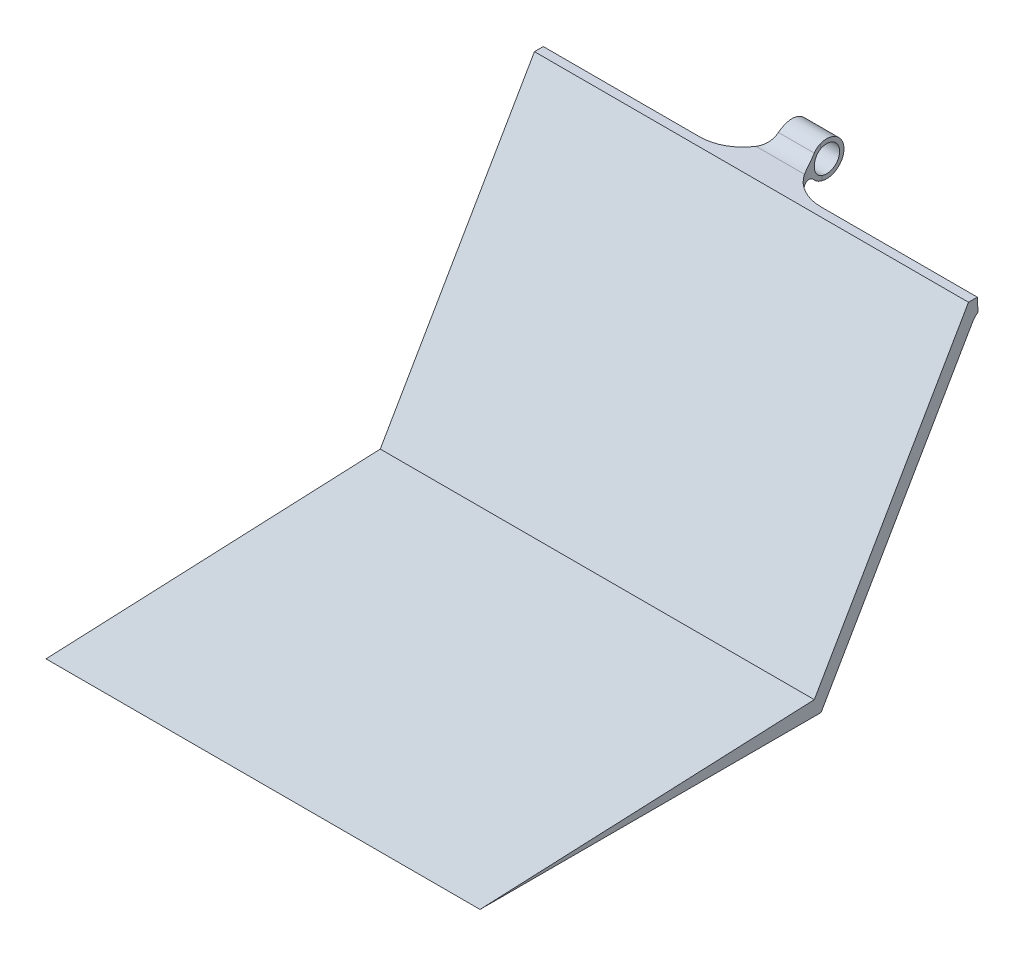
from build123d import *

# Parameters (mm, degrees)
SKETCH1_R           = 3
BOSS_EXTRUDE1_DEPTH = 50
SKETCH2_W           = 49.237563161
SKETCH2_H           = 20.165956609
CUT_EXTRUDE1_DEPTH  = 35
FILLET1_R           = 10
FILLET3_START       = -50
FILLET3_DEPTH       = 100
FILLET3_START_2     = -14.0000001
FILLET3_2_DEPTH     = 28.0000001
FILLET3_START_3     = 5.029081153
FILLET3_3_DEPTH     = 7.627254367
FILLET4_R           = 5


with BuildPart() as part:
    # Sketch1 → Boss-Extrude1 (new, symmetric)
    with BuildSketch(Plane(origin=(0, 0, 0), x_dir=(0, 0, -1), z_dir=(1, 0, 0))):
        with BuildLine():
            Line((8.951712986, 8.463111178), (1.809964066, 8.463111178))
            Line((1.809964066, 8.463111178), (-10.541427431, -12.930126439))
            Line((-10.541427431, -12.930126439), (-20.432636562, -30.062203202))
            Line((-20.432636562, -30.062203202), (-34.461620266, -54.361115756))
            Line((-34.461620266, -54.361115756), (-113.02909109, -54.361115756))
            Line((-113.02909109, -54.361115756), (-36.018105083, -51.005100845))
            Line((-36.018105083, -51.005100845), (-0.492985983, 10.526210382))
            Line((-0.492985983, 10.526210382), (8.951712986, 10.526210382))
            ThreePointArc((8.951712986, 10.526210382), (16.816412899, 9.49466078), (8.951712986, 8.463111178))
        make_face()
        with Locations((12.816412899, 9.49466078)):
            Circle(SKETCH1_R, mode=Mode.SUBTRACT)
    extrude(amount=BOSS_EXTRUDE1_DEPTH, both=True)

    # Sketch2 → Cut-Extrude1 (cut, symmetric)
    with BuildSketch(Plane(origin=(0, -11.420787425, -0.571112862), x_dir=(1, 0, 0), z_dir=(0, 0.9987520183198841, 0.04994402769058576))):
        Polygon((-41.345711691, -80.976381383), (-37.345711691, -80.976381383), (-37.345711691, -96.642858944), (-33.68226718, -102.621642139), (-29.345711691, -96.642858944), (-29.345711691, -80.976381383), (-25.345711691, -80.976381383), (-25.345711691, -96.642858944), (-21.68226718, -102.621642139), (-17.345711691, -96.642858944), (-17.345711691, -80.976381383), (-13.345711691, -80.976381383), (-13.345711691, -96.642858944), (-9.68226718, -102.621642139), (-5.345711691, -96.642858944), (-5.345711691, -80.976381383), (-1.345711691, -80.976381383), (-1.345711691, -96.642858944), (2.31773282, -102.621642139), (6.654288309, -96.642858944), (6.654288309, -80.976381383), (10.654288309, -80.976381383), (10.654288309, -96.642858944), (14.31773282, -102.621642139), (18.654288309, -96.642858944), (18.654288309, -80.976381383), (22.654288309, -80.976381383), (22.654288309, -96.642858944), (26.31773282, -102.621642139), (30.654288309, -96.642858944), (30.654288309, -80.976381383), (34.654288309, -80.976381383), (34.654288309, -96.642858944), (38.31773282, -102.621642139), (42.654288309, -96.642858944), (42.654288309, -80.976381383), (46.654288309, -80.976381383), (46.654288309, -96.642858944), (50.31773282, -102.621642139), (54.654288309, -96.642858944), (54.654288309, -80.976381383), (58.654288309, -80.976381383), (58.654288309, -96.642858944), (58.654288309, -117.647520094), (-58.342792285, -117.647520094), (-58.342792285, -96.642858944), (-49.345711691, -96.642858944), (-45.68226718, -102.621642139), (-41.345711691, -96.642858944), align=None)
        with Locations((-28.618781581, 12.150846953)):
            Rectangle(SKETCH2_W, SKETCH2_H)
        with Locations((28.618781581, 12.150846953)):
            Rectangle(SKETCH2_W, SKETCH2_H)
    extrude(amount=CUT_EXTRUDE1_DEPTH, both=True, mode=Mode.SUBTRACT)

    # Fillet1
    # the kernel refuses this fillet: 10 mm, written as the material it adds along each edge
    with BuildSketch(Plane(origin=(-4, 35.49501084, -0.295473589), x_dir=(0, 0.049944027690585764, -0.9987520183198841), z_dir=(0, -0.9987520183198841, -0.04994402769058576))) as fillet1_piece_1_section:
        with BuildLine():
            CenterArc((FILLET1_R, -FILLET1_R), FILLET1_R, 90, 90)
            Line((0, -FILLET1_R), (0, 0))
            Line((0, 0), (FILLET1_R, 0))
        make_face()
    fillet1_piece_1 = extrude(amount=52.325377672, mode=Mode.PRIVATE)
    fillet1_piece_1 = split(fillet1_piece_1, bisect_by=Plane(origin=(-4, 8.463111178, -0.295473589), z_dir=(0, 1, 0)), keep=Keep.TOP, mode=Mode.PRIVATE)
    fillet1_piece_1 = split(fillet1_piece_1, bisect_by=Plane(origin=(-4, 10.526210382, -0.295473589), z_dir=(0, -1, 0)), keep=Keep.TOP, mode=Mode.PRIVATE)
    fillet1_piece_1 = fillet1_piece_1 - Plane(origin=(-4, 9.49466078, -12.816412899), x_dir=(0, 0, -1), z_dir=(-1, 0, 0)) * Cylinder(3, 145, mode=Mode.PRIVATE)
    add(fillet1_piece_1)
    with BuildSketch(Plane(origin=(-4, 35.49501084, -0.295473589), x_dir=(0, 0.049944027690585764, -0.9987520183198841), z_dir=(0, -0.9987520183198841, -0.04994402769058576))) as fillet1_piece_2_section:
        with BuildLine():
            CenterArc((FILLET1_R, -FILLET1_R), FILLET1_R, 90, 90)
            Line((0, -FILLET1_R), (0, 0))
            Line((0, 0), (FILLET1_R, 0))
        make_face()
    fillet1_piece_2 = extrude(amount=52.325377672, mode=Mode.PRIVATE)
    fillet1_piece_2 = split(fillet1_piece_2, bisect_by=Plane(origin=(-4, 28.081242311, -13.136497357), z_dir=(0, 0.4999999999999977, 0.8660254037844399)), keep=Keep.TOP, mode=Mode.PRIVATE)
    fillet1_piece_2 = split(fillet1_piece_2, bisect_by=Plane(origin=(-4, 10.526210382, -0.295473589), z_dir=(0, -1, 0)), keep=Keep.TOP, mode=Mode.PRIVATE)
    add(fillet1_piece_2)
    with BuildSketch(Plane(origin=(-4, 35.49501084, -0.295473589), x_dir=(0, 0.049944027690585764, -0.9987520183198841), z_dir=(0, -0.9987520183198841, -0.04994402769058576))) as fillet1_piece_3_section:
        with BuildLine():
            CenterArc((FILLET1_R, -FILLET1_R), FILLET1_R, 90, 90)
            Line((0, -FILLET1_R), (0, 0))
            Line((0, 0), (FILLET1_R, 0))
        make_face()
    fillet1_piece_3 = extrude(amount=52.325377672, mode=Mode.PRIVATE)
    fillet1_piece_3 = fillet1_piece_3 & Plane(origin=(-4, 9.49466078, -12.816412899), x_dir=(0, 0.2578874004491323, 0.9661749782982318), z_dir=(1, 0, 0)) * Cylinder(4, 145, mode=Mode.PRIVATE)
    fillet1_piece_3 = fillet1_piece_3 - Plane(origin=(-4, 9.49466078, -12.816412899), x_dir=(0, 0, -1), z_dir=(-1, 0, 0)) * Cylinder(3, 145, mode=Mode.PRIVATE)
    add(fillet1_piece_3)
    with BuildSketch(Plane(origin=(4, -16.76506572, -2.908813701), x_dir=(0, 0.049944027690585764, -0.9987520183198841), z_dir=(0, 0.9987520183198841, 0.04994402769058576))) as fillet1_piece_4_section:
        with BuildLine():
            CenterArc((FILLET1_R, -FILLET1_R), FILLET1_R, 90, 90)
            Line((0, -FILLET1_R), (0, 0))
            Line((0, 0), (FILLET1_R, 0))
        make_face()
    fillet1_piece_4 = extrude(amount=52.325377672, mode=Mode.PRIVATE)
    fillet1_piece_4 = split(fillet1_piece_4, bisect_by=Plane(origin=(4, -9.982205646, 8.839444568), z_dir=(0, 0.4999999999999977, 0.8660254037844399)), keep=Keep.TOP, mode=Mode.PRIVATE)
    fillet1_piece_4 = split(fillet1_piece_4, bisect_by=Plane(origin=(4, 10.526210382, -2.908813701), z_dir=(0, -1, 0)), keep=Keep.TOP, mode=Mode.PRIVATE)
    add(fillet1_piece_4)
    with BuildSketch(Plane(origin=(4, -16.76506572, -2.908813701), x_dir=(0, 0.049944027690585764, -0.9987520183198841), z_dir=(0, 0.9987520183198841, 0.04994402769058576))) as fillet1_piece_5_section:
        with BuildLine():
            CenterArc((FILLET1_R, -FILLET1_R), FILLET1_R, 90, 90)
            Line((0, -FILLET1_R), (0, 0))
            Line((0, 0), (FILLET1_R, 0))
        make_face()
    fillet1_piece_5 = extrude(amount=52.325377672, mode=Mode.PRIVATE)
    fillet1_piece_5 = split(fillet1_piece_5, bisect_by=Plane(origin=(4, 8.463111178, -2.908813701), z_dir=(0, 1, 0)), keep=Keep.TOP, mode=Mode.PRIVATE)
    fillet1_piece_5 = split(fillet1_piece_5, bisect_by=Plane(origin=(4, 10.526210382, -2.908813701), z_dir=(0, -1, 0)), keep=Keep.TOP, mode=Mode.PRIVATE)
    fillet1_piece_5 = fillet1_piece_5 - Plane(origin=(4, 9.49466078, -12.816412899), x_dir=(0, 0, -1), z_dir=(-1, 0, 0)) * Cylinder(3, 145, mode=Mode.PRIVATE)
    add(fillet1_piece_5)
    with BuildSketch(Plane(origin=(4, -16.76506572, -2.908813701), x_dir=(0, 0.049944027690585764, -0.9987520183198841), z_dir=(0, 0.9987520183198841, 0.04994402769058576))) as fillet1_piece_6_section:
        with BuildLine():
            CenterArc((FILLET1_R, -FILLET1_R), FILLET1_R, 90, 90)
            Line((0, -FILLET1_R), (0, 0))
            Line((0, 0), (FILLET1_R, 0))
        make_face()
    fillet1_piece_6 = extrude(amount=52.325377672, mode=Mode.PRIVATE)
    fillet1_piece_6 = fillet1_piece_6 & Plane(origin=(4, 9.49466078, -12.816412899), x_dir=(0, 0.2578874004491323, 0.9661749782982318), z_dir=(1, 0, 0)) * Cylinder(4, 145, mode=Mode.PRIVATE)
    fillet1_piece_6 = fillet1_piece_6 - Plane(origin=(4, 9.49466078, -12.816412899), x_dir=(0, 0, -1), z_dir=(-1, 0, 0)) * Cylinder(3, 145, mode=Mode.PRIVATE)
    add(fillet1_piece_6)

    # Fillet3: read off the stored shape, not the designer's step
    # Fillet3 outline → Fillet3 (add)
    with BuildSketch(Plane.YZ.offset(FILLET3_START)):
        with BuildLine():
            Line((7.463496818, -1.697229668), (8.203734738, -1.660213009))
            Line((8.203734738, -1.660213009), (5.963111178, -0.366588393))
            ThreePointArc((5.963111178, -0.366588393), (6.780701406, -0.955914016), (7.463496818, -1.697229668))
        make_face()
    extrude(amount=FILLET3_DEPTH)

    # Fillet3 2 outline → Fillet3 2 (add)
    with BuildSketch(Plane.YZ.offset(FILLET3_START_2)):
        with BuildLine():
            Line((8.463111178, -1.809964066), (8.203734738, -1.660213009))
            Line((8.203734738, -1.660213009), (7.463496818, -1.697229668))
            ThreePointArc((7.463496818, -1.697229668), (8.206629292, -3.115881487), (8.463111178, -4.696715412))
            Line((8.463111178, -4.696715412), (8.463111178, -1.809964066))
        make_face()
    extrude(amount=FILLET3_2_DEPTH)

    # Fillet3 3 outline → Fillet3 3 (cut)
    with BuildSketch(Plane(origin=(0, 0, 0), x_dir=(1, 0, 0), z_dir=(0, 0.998752018319884, 0.0499440276905858)).offset(FILLET3_START_3)):
        with BuildLine():
            ThreePointArc((-14, 2.067868648), (-9.034050266, 3.38804473), (-5.379286145, 7))
            Line((-5.379286145, 7), (-14.0000001, 7))
            Line((-14.0000001, 7), (-14, 2.067868648))
        make_face()
        with BuildLine():
            Line((14, 7), (5.379286145, 7))
            ThreePointArc((5.379286145, 7), (9.034050266, 3.38804473), (14, 2.067868648))
            Line((14, 2.067868648), (14, 7))
        make_face()
    extrude(amount=FILLET3_3_DEPTH, mode=Mode.SUBTRACT)

    # Fillet4
    # the kernel refuses this fillet: 5 mm, written as the material it adds along each edge
    with BuildSketch(Plane(origin=(-11.410578331, 8.463111178, -8.951712972), x_dir=(-4.3911864757766885e-10, -0.8787125753545649, -0.47735124375426957), z_dir=(1.0, 9.37113186758836e-13, -9.216318308073321e-10))) as fillet4_piece_1_section:
        with BuildLine():
            CenterArc((3.049747005, -4.860464878), FILLET4_R, 103.567804979, 47.919645029)
            Line((-1.343815871, -2.473708659), (0, 0))
            ThreePointArc((0, 0), (0.938383697, -0.111628098), (1.876767394, 0))
        make_face()
    fillet4_piece_1 = extrude(amount=15.410578331, mode=Mode.PRIVATE)
    fillet4_piece_1 = fillet4_piece_1 - Plane(origin=(-14, 8.598192062, -11.652983015), x_dir=(0, 0.04994402769099318, -0.9987520183198637), z_dir=(0, 0.9987520183198637, 0.04994402769099318)) * Cylinder(10, 41, mode=Mode.PRIVATE)
    add(fillet4_piece_1)
    with BuildSketch(Plane(origin=(-11.382224103, 10.526210382, -8.951712986), x_dir=(4.174135827959178e-15, 0.8787125762173496, -0.47735124216604746), z_dir=(1, 0, 0))) as fillet4_piece_2_section:
        with BuildLine():
            CenterArc((3.049747012, 4.860464876), FILLET4_R, 208.512549888, 47.919645029)
            Line((-1.343815869, 2.473708665), (0, 0))
            ThreePointArc((0, 0), (0.938383696, 0.111628099), (1.876767392, 0))
        make_face()
    fillet4_piece_2 = extrude(amount=22.764448206, mode=Mode.PRIVATE)
    fillet4_piece_2 = fillet4_piece_2 - Plane(origin=(14, 10.656145058, -11.550072123), x_dir=(0, 0.04994402769099318, -0.9987520183198637), z_dir=(0, -0.9987520183198637, -0.04994402769099318)) * Cylinder(10, 56, mode=Mode.PRIVATE)
    fillet4_piece_2 = fillet4_piece_2 - Plane(origin=(-14, 10.656145058, -11.550072123), x_dir=(0, 0.04994402769099318, -0.9987520183198637), z_dir=(0, 0.9987520183198637, 0.04994402769099318)) * Cylinder(10, 56, mode=Mode.PRIVATE)
    add(fillet4_piece_2)
    with BuildSketch(Plane(origin=(4, 8.463111178, -8.951712986), x_dir=(0, -0.8787125762172517, -0.4773512421662278), z_dir=(1, 0, 0))) as fillet4_piece_3_section:
        with BuildLine():
            CenterArc((3.049747012, -4.860464876), FILLET4_R, 103.567805083, 47.919645029)
            Line((-1.343815869, -2.473708665), (0, 0))
            ThreePointArc((0, 0), (0.938383696, -0.111628099), (1.876767392, 0))
        make_face()
    fillet4_piece_3 = extrude(amount=7.41057834, mode=Mode.PRIVATE)
    fillet4_piece_3 = fillet4_piece_3 - Plane(origin=(14, 8.598192062, -11.652983015), x_dir=(0, 0.04994402769099318, -0.9987520183198637), z_dir=(0, -0.9987520183198637, -0.04994402769099318)) * Cylinder(10, 25, mode=Mode.PRIVATE)
    add(fillet4_piece_3)


solid = part.part
